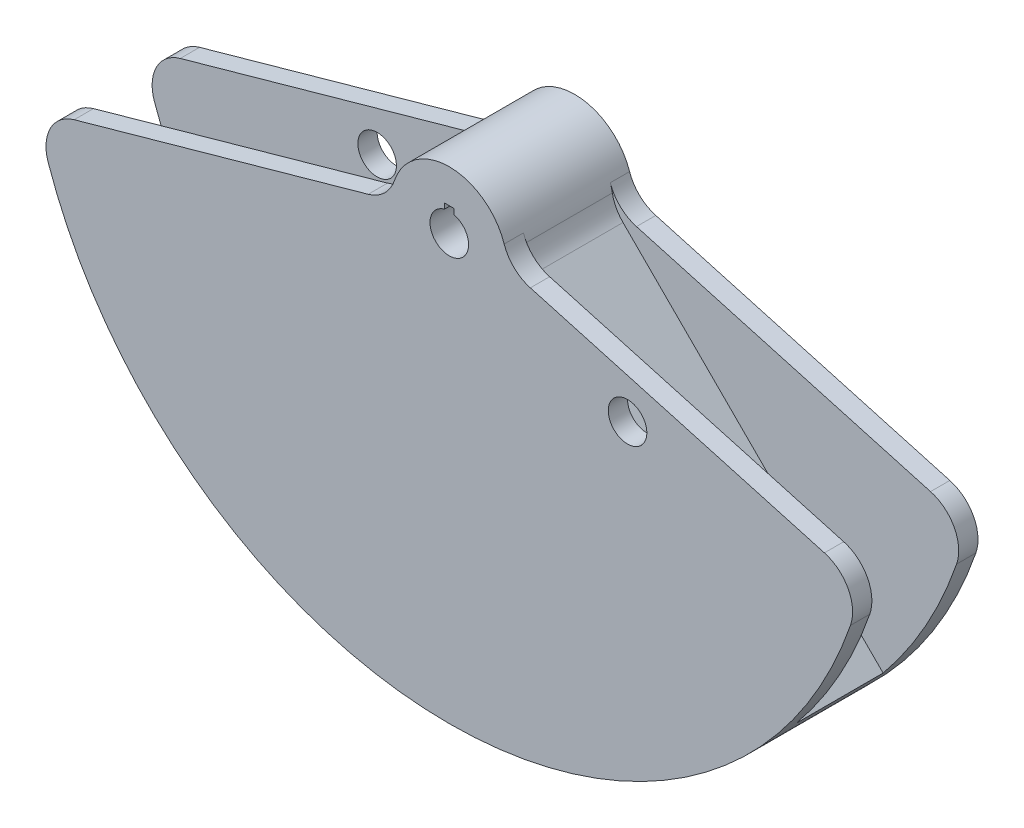
from build123d import *

# Parameters (mm, degrees)
SKETCH1_R               = 12.7
BOSS_EXTRUDE1_DEPTH     = 28.575
BOSS_EXTRUDE2_START     = 12.7
SKETCH5_R               = 12.7
BOSS_EXTRUDE2_DEPTH     = 12.7
SKETCH6_R               = 12.7
BOSS_EXTRUDE4_DEPTH     = 12.7
CUT_EXTRUDE1_DEPTH      = 388.597582747
CUT_EXTRUDE1_DEPTH_BACK = 388.597582747
SKETCH8_W               = 6.35
SKETCH8_H               = 6.35


with BuildPart() as part:
    # Sketch1 → Boss-Extrude1 (new, symmetric)
    with BuildSketch(Plane.XY):
        with BuildLine():
            Line((-215.695054603, -177.595054603), (-44.473355081, -6.373355081))
            ThreePointArc((-44.473355081, -6.373355081), (-39.956621227, -0.242188042), (-37.460320394, 6.952294297))
            ThreePointArc((-37.460320394, 6.952294297), (0, 38.1), (37.460320394, 6.952294297))
            ThreePointArc((37.460320394, 6.952294297), (39.956621227, -0.242188042), (44.473355081, -6.373355081))
            Line((44.473355081, -6.373355081), (215.695054603, -177.595054603))
            ThreePointArc((215.695054603, -177.595054603), (0, -279.4), (-215.695054603, -177.595054603))
        make_face()
        Circle(SKETCH1_R, mode=Mode.SUBTRACT)
    extrude(amount=BOSS_EXTRUDE1_DEPTH, both=True)

    # Sketch5 → Boss-Extrude2 (add)
    with BuildSketch(Plane.XY.offset(28.575).offset(BOSS_EXTRUDE2_START)):
        with BuildLine():
            Line((-246.90917958, -58.560550716), (-53.349403067, -4.276696281))
            ThreePointArc((-53.349403067, -4.276696281), (-42.702025606, 1.776101798), (-36.124925788, 12.107837827))
            ThreePointArc((-36.124925788, 12.107837827), (0, 38.1), (36.124925788, 12.107837827))
            ThreePointArc((36.124925788, 12.107837827), (42.702025606, 1.776101798), (53.349403067, -4.276696281))
            Line((53.349403067, -4.276696281), (246.90917958, -58.560550716))
            ThreePointArc((246.90917958, -58.560550716), (262.554103386, -71.238092264), (264.055410302, -91.318674379))
            ThreePointArc((264.055410302, -91.318674379), (0, -279.4), (-264.055410302, -91.318674379))
            ThreePointArc((-264.055410302, -91.318674379), (-262.554103386, -71.238092264), (-246.90917958, -58.560550716))
        make_face()
        Circle(SKETCH5_R, mode=Mode.SUBTRACT)
        with Locations((117.332700629, -48.60079591)):
            Circle(SKETCH5_R, mode=Mode.SUBTRACT)
    extrude(amount=-BOSS_EXTRUDE2_DEPTH)

    # Sketch6 → Boss-Extrude4 (add)
    with BuildSketch(Plane(origin=(0, 0, -28.575), x_dir=(-1, 0, 0), z_dir=(0, 0, -1))):
        with BuildLine():
            Line((-246.90917958, -58.560550716), (-53.349403067, -4.276696281))
            ThreePointArc((-53.349403067, -4.276696281), (-42.702025606, 1.776101798), (-36.124925788, 12.107837827))
            ThreePointArc((-36.124925788, 12.107837827), (0, 38.1), (36.124925788, 12.107837827))
            ThreePointArc((36.124925788, 12.107837827), (42.702025606, 1.776101798), (53.349403067, -4.276696281))
            Line((53.349403067, -4.276696281), (246.90917958, -58.560550716))
            ThreePointArc((246.90917958, -58.560550716), (262.554103386, -71.238092264), (264.055410302, -91.318674379))
            ThreePointArc((264.055410302, -91.318674379), (0, -279.4), (-264.055410302, -91.318674379))
            ThreePointArc((-264.055410302, -91.318674379), (-262.554103386, -71.238092264), (-246.90917958, -58.560550716))
        make_face()
        Circle(SKETCH6_R, mode=Mode.SUBTRACT)
        with Locations((117.332700629, -48.60079591)):
            Circle(SKETCH6_R, mode=Mode.SUBTRACT)
    extrude(amount=BOSS_EXTRUDE4_DEPTH)

    # Sketch8 → Cut-Extrude1 (cut, two sides: drawn at the far end of the back side and taken through both)
    with BuildSketch(Plane.XY.offset(-CUT_EXTRUDE1_DEPTH_BACK)):
        with Locations((0, 12.7)):
            Rectangle(SKETCH8_W, SKETCH8_H)
    extrude(amount=CUT_EXTRUDE1_DEPTH + CUT_EXTRUDE1_DEPTH_BACK, mode=Mode.SUBTRACT)


solid = part.part
